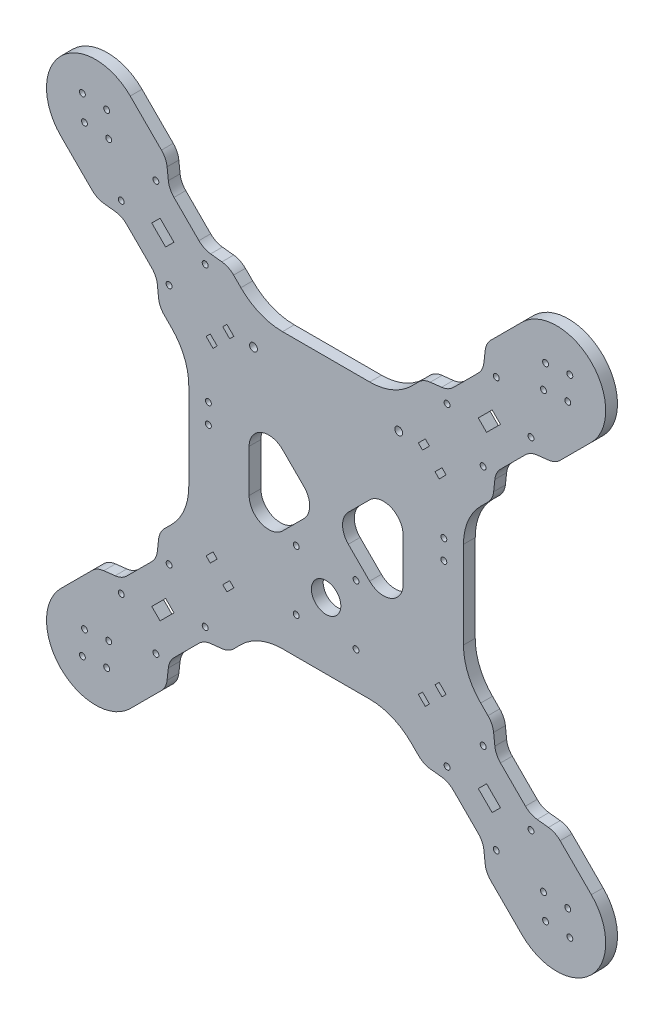
from build123d import *

# Parameters (mm, degrees)
BOSS_EXTRUDE1_DEPTH      = 6
FILLET1_R                = 30
SKETCH8_R                = 1.5
CUT_EXTRUDE1_DEPTH       = 202.614731605
SKETCH9_R                = 1.5
CUT_EXTRUDE2_DEPTH       = 202.614731605
MIRROR2_COPY_1_SKETCH_R  = 1.5
MIRROR2_COPY_1_DEPTH     = 202.614731605
MIRROR2_COPY_2_SKETCH_R  = 1.5
MIRROR2_COPY_2_DEPTH     = 202.614731605
MIRROR2_COPY_3_SKETCH_R  = 1.5
MIRROR2_COPY_3_DEPTH     = 202.614731605
MIRROR2_COPY_4_SKETCH_R  = 1.5
MIRROR2_COPY_4_DEPTH     = 202.614731605
CUT_EXTRUDE3_DEPTH       = 202.614731605
CUT_EXTRUDE3_DEPTH_BACK  = 202.614731605
SKETCH10_R               = 1.5
SKETCH10_R_2             = 1.499999999
SKETCH10_R_3             = 7.5
SKETCH10_R_4             = 2
FILLET2_R                = 10
CUT_EXTRUDE4_DEPTH       = 202.614731605
CIRPATTERN2_COUNT        = 4
CIRPATTERN2_COPY_1_DEPTH = 202.614731605
CIRPATTERN2_COPY_2_DEPTH = 202.614731605
CIRPATTERN2_COPY_3_DEPTH = 202.614731605
FILLET3_R                = 10


with BuildPart() as part:
    # Sketch4 → Boss-Extrude1 (new body)
    with BuildSketch(Plane.XY):
        with BuildLine():
            Line((-70, -34.644660941), (-70, 34.644660941))
            Line((-70, 34.644660941), (-135.17766953, 99.82233047))
            ThreePointArc((-135.17766953, 99.82233047), (-135.17766953, 135.17766953), (-99.82233047, 135.17766953))
            Line((-99.82233047, 135.17766953), (-34.644660941, 70))
            Line((-34.644660941, 70), (34.644660941, 70))
            Line((34.644660941, 70), (99.82233047, 135.17766953))
            ThreePointArc((99.82233047, 135.17766953), (135.17766953, 135.17766953), (135.17766953, 99.82233047))
            Line((135.17766953, 99.82233047), (70, 34.644660941))
            Line((70, 34.644660941), (70, -34.644660941))
            Line((70, -34.644660941), (135.17766953, -99.82233047))
            ThreePointArc((135.17766953, -99.82233047), (135.17766953, -135.17766953), (99.82233047, -135.17766953))
            Line((99.82233047, -135.17766953), (34.644660941, -70))
            Line((34.644660941, -70), (-34.644660941, -70))
            Line((-34.644660941, -70), (-99.82233047, -135.17766953))
            ThreePointArc((-99.82233047, -135.17766953), (-135.17766953, -135.17766953), (-135.17766953, -99.82233047))
            Line((-135.17766953, -99.82233047), (-70, -34.644660941))
        make_face()
    extrude(amount=BOSS_EXTRUDE1_DEPTH)

    # Fillet1
    fillet1_edges = [part.edges().sort_by_distance(p)[0] for p in [
        (34.644660941, -70, 3),
        (70, -34.644660941, 3),
        (70, 34.644660941, 3),
        (34.644660941, 70, 3),
        (-34.644660941, 70, 3),
        (-70, 34.644660941, 3),
        (-70, -34.644660941, 3),
        (-34.644660941, -70, 3),
    ]]
    fillet(fillet1_edges, radius=FILLET1_R)

    # Sketch8 → Cut-Extrude1 (cut, symmetric)
    with BuildSketch(Plane.XY.offset(6)):
        with Locations((-104.418524548, 86.740855018)):
            Circle(SKETCH8_R)
        with Locations((-80.023340597, 61.638564286)):
            Circle(SKETCH8_R)
        with Locations((-86.740855018, 104.418524548)):
            Circle(SKETCH8_R)
        with Locations((-61.638564286, 80.023340597)):
            Circle(SKETCH8_R)
        Polygon((-88.862175362, 84.619534675), (-84.619534675, 88.862175362), (-77.548466863, 81.79110755), (-81.79110755, 77.548466863), align=None)
    cut_extrude1 = extrude(amount=CUT_EXTRUDE1_DEPTH, both=True, mode=Mode.SUBTRACT)

    # Sketch9 → Cut-Extrude2 (cut, symmetric)
    with BuildSketch(Plane.XY.offset(6)):
        with Locations((-124.217514421, 124.217514421)):
            Circle(SKETCH9_R)
        with Locations((-110.782485579, 110.782485579)):
            Circle(SKETCH9_R)
        with Locations((-123.156854249, 111.843145751)):
            Circle(SKETCH9_R)
        with Locations((-111.843145751, 123.156854249)):
            Circle(SKETCH9_R)
    cut_extrude2 = extrude(amount=CUT_EXTRUDE2_DEPTH, both=True, mode=Mode.SUBTRACT)

    # Mirror1: Cut-Extrude1, Cut-Extrude2 across plane
    add(cut_extrude1.mirror(Plane(origin=(0, 0, 0), x_dir=(0, 0, 1), z_dir=(1, 0, 0))), mode=Mode.SUBTRACT)
    add(cut_extrude2.mirror(Plane(origin=(0, 0, 0), x_dir=(0, 0, 1), z_dir=(1, 0, 0))), mode=Mode.SUBTRACT)

    # Mirror2 copy 1 sketch → Mirror2 copy 1 (cut, symmetric)
    with BuildSketch(Plane(origin=(0, 0, 6), x_dir=(-1, 0, 0), z_dir=(0, 0, 1))):
        with Locations((-104.418524548, 86.740855018)):
            Circle(MIRROR2_COPY_1_SKETCH_R)
        with Locations((-80.023340597, 61.638564286)):
            Circle(MIRROR2_COPY_1_SKETCH_R)
        with Locations((-86.740855018, 104.418524548)):
            Circle(MIRROR2_COPY_1_SKETCH_R)
        with Locations((-61.638564286, 80.023340597)):
            Circle(MIRROR2_COPY_1_SKETCH_R)
        Polygon((-88.862175362, 84.619534675), (-84.619534675, 88.862175362), (-77.548466863, 81.79110755), (-81.79110755, 77.548466863), align=None)
    extrude(amount=MIRROR2_COPY_1_DEPTH, both=True, mode=Mode.SUBTRACT)

    # Mirror2 copy 2 sketch → Mirror2 copy 2 (cut, symmetric)
    with BuildSketch(Plane(origin=(0, 0, 6), x_dir=(-1, 0, 0), z_dir=(0, 0, 1))):
        with Locations((-124.217514421, 124.217514421)):
            Circle(MIRROR2_COPY_2_SKETCH_R)
        with Locations((-110.782485579, 110.782485579)):
            Circle(MIRROR2_COPY_2_SKETCH_R)
        with Locations((-123.156854249, 111.843145751)):
            Circle(MIRROR2_COPY_2_SKETCH_R)
        with Locations((-111.843145751, 123.156854249)):
            Circle(MIRROR2_COPY_2_SKETCH_R)
    extrude(amount=MIRROR2_COPY_2_DEPTH, both=True, mode=Mode.SUBTRACT)

    # Mirror2 copy 3 sketch → Mirror2 copy 3 (cut, symmetric)
    with BuildSketch(Plane.XY.offset(6)):
        with Locations((-104.418524548, -86.740855018)):
            Circle(MIRROR2_COPY_3_SKETCH_R)
        with Locations((-80.023340597, -61.638564286)):
            Circle(MIRROR2_COPY_3_SKETCH_R)
        with Locations((-86.740855018, -104.418524548)):
            Circle(MIRROR2_COPY_3_SKETCH_R)
        with Locations((-61.638564286, -80.023340597)):
            Circle(MIRROR2_COPY_3_SKETCH_R)
        Polygon((-88.862175362, -84.619534675), (-84.619534675, -88.862175362), (-77.548466863, -81.79110755), (-81.79110755, -77.548466863), align=None)
    extrude(amount=MIRROR2_COPY_3_DEPTH, both=True, mode=Mode.SUBTRACT)

    # Mirror2 copy 4 sketch → Mirror2 copy 4 (cut, symmetric)
    with BuildSketch(Plane.XY.offset(6)):
        with Locations((-124.217514421, -124.217514421)):
            Circle(MIRROR2_COPY_4_SKETCH_R)
        with Locations((-110.782485579, -110.782485579)):
            Circle(MIRROR2_COPY_4_SKETCH_R)
        with Locations((-123.156854249, -111.843145751)):
            Circle(MIRROR2_COPY_4_SKETCH_R)
        with Locations((-111.843145751, -123.156854249)):
            Circle(MIRROR2_COPY_4_SKETCH_R)
    extrude(amount=MIRROR2_COPY_4_DEPTH, both=True, mode=Mode.SUBTRACT)

    # Sketch10 → Cut-Extrude3 (cut, two sides: drawn at the far end of the back side and taken through both)
    with BuildSketch(Plane.XY.offset(6).offset(-CUT_EXTRUDE3_DEPTH_BACK)):
        with Locations((-60, 20)):
            Circle(SKETCH10_R)
        with Locations((-60, 10)):
            Circle(SKETCH10_R)
        with Locations((60, 20)):
            Circle(SKETCH10_R)
        with Locations((60, 10)):
            Circle(SKETCH10_R)
        with Locations((-15.249999999, -21)):
            Circle(SKETCH10_R_2)
        with Locations((15.249999999, -21)):
            Circle(SKETCH10_R)
        with Locations((-15.249999999, -51.5)):
            Circle(SKETCH10_R_2)
        with Locations((15.249999999, -51.5)):
            Circle(SKETCH10_R)
        with Locations((0, -36.249999999)):
            Circle(SKETCH10_R_3)
        with Locations((-37, 55.742640687)):
            Circle(SKETCH10_R_4)
        with Locations((37, 55.742640687)):
            Circle(SKETCH10_R_4)
        Polygon((-49.142135624, -53.384776311), (-47.02081528, -55.506096654), (-50.556349186, -59.04163056), (-52.67766953, -56.920310217), align=None)
        Polygon((-4.242640687, 0), (-39.242640687, 35), (-39.242640687, -35), align=None)
        Polygon((39.242640687, 35), (39.242640687, -35), (4.242640687, 0), align=None)
        Polygon((-57.627416998, -44.899494937), (-55.506096654, -47.02081528), (-59.04163056, -50.556349186), (-61.162950904, -48.435028843), align=None)
        Polygon((-61.162950904, 48.435028843), (-59.04163056, 50.556349186), (-55.506096654, 47.02081528), (-57.627416998, 44.899494937), align=None)
        Polygon((57.627416998, 44.899494937), (55.506096654, 47.02081528), (59.04163056, 50.556349186), (61.162950904, 48.435028843), align=None)
        Polygon((61.162950904, -48.435028843), (57.627416998, -44.899494937), (55.506096654, -47.02081528), (59.04163056, -50.556349186), align=None)
        Polygon((-52.67766953, 56.920310217), (-50.556349186, 59.04163056), (-47.02081528, 55.506096654), (-49.142135624, 53.384776311), align=None)
        Polygon((52.67766953, -56.920310217), (49.142135624, -53.384776311), (47.02081528, -55.506096654), (50.556349186, -59.04163056), align=None)
        Polygon((49.142135624, 53.384776311), (47.02081528, 55.506096654), (50.556349186, 59.04163056), (52.67766953, 56.920310217), align=None)
    extrude(amount=CUT_EXTRUDE3_DEPTH + CUT_EXTRUDE3_DEPTH_BACK, mode=Mode.SUBTRACT)

    # Fillet2
    fillet2_edges = [part.edges().sort_by_distance(p)[0] for p in [
        (4.242640687, 0, 3),
        (39.242640687, -35, 3),
        (39.242640687, 35, 3),
        (-39.242640687, -35, 3),
        (-39.242640687, 35, 3),
        (-4.242640687, 0, 3),
    ]]
    fillet(fillet2_edges, radius=FILLET2_R)

    # Sketch11 → Cut-Extrude4 (cut, symmetric)
    with BuildSketch(Plane.XY.offset(6)):
        Polygon((-80.023340597, 104.064971157), (-62.345671067, 86.387301628), (-49.617749006, 84.973088065), (-81.437554159, 116.792893219), align=None)
    cut_extrude4 = extrude(amount=CUT_EXTRUDE4_DEPTH, both=True, mode=Mode.SUBTRACT)

    # Mirror4: Cut-Extrude4 across plane
    add(cut_extrude4.mirror(Plane(origin=(0, 0, 0), x_dir=(0, 0, 1), z_dir=(0.7071067811865474, 0.7071067811865477, 0))), mode=Mode.SUBTRACT)

    # CirPattern2: Cut-Extrude4 ×4 about axis
    cirpattern2_axis = Axis((0, 0, 0), (0, 0, 1))
    for i in range(1, CIRPATTERN2_COUNT):
        add(cut_extrude4.rotate(cirpattern2_axis, i * 360 / CIRPATTERN2_COUNT), mode=Mode.SUBTRACT)

    # CirPattern2 copy 1 sketch → CirPattern2 copy 1 (cut, symmetric)
    with BuildSketch(Plane.XY.offset(6)):
        Polygon((-80.023340597, -104.064971157), (-62.345671067, -86.387301628), (-49.617749006, -84.973088065), (-81.437554159, -116.792893219), align=None)
    extrude(amount=CIRPATTERN2_COPY_1_DEPTH, both=True, mode=Mode.SUBTRACT)

    # CirPattern2 copy 2 sketch → CirPattern2 copy 2 (cut, symmetric)
    with BuildSketch(Plane(origin=(0, 0, 6), x_dir=(0, 1, 0), z_dir=(0, 0, 1))):
        Polygon((-80.023340597, -104.064971157), (-62.345671067, -86.387301628), (-49.617749006, -84.973088065), (-81.437554159, -116.792893219), align=None)
    extrude(amount=CIRPATTERN2_COPY_2_DEPTH, both=True, mode=Mode.SUBTRACT)

    # CirPattern2 copy 3 sketch → CirPattern2 copy 3 (cut, symmetric)
    with BuildSketch(Plane(origin=(0, 0, 6), x_dir=(-1, 0, 0), z_dir=(0, 0, 1))):
        Polygon((-80.023340597, -104.064971157), (-62.345671067, -86.387301628), (-49.617749006, -84.973088065), (-81.437554159, -116.792893219), align=None)
    extrude(amount=CIRPATTERN2_COPY_3_DEPTH, both=True, mode=Mode.SUBTRACT)

    # Fillet3
    fillet3_edges = [part.edges().sort_by_distance(p)[0] for p in [
        (-49.617749006, 84.973088065, 3),
        (-62.345671067, 86.387301628, 3),
        (-80.023340597, 104.064971157, 3),
        (-81.437554159, 116.792893219, 3),
        (116.792893219, 81.437554159, 3),
        (104.064971157, 80.023340597, 3),
        (86.387301628, 62.345671067, 3),
        (84.973088065, 49.617749006, 3),
        (80.023340597, 104.064971157, 3),
        (81.437554159, 116.792893219, 3),
        (62.345671067, 86.387301628, 3),
        (49.617749006, 84.973088065, 3),
        (116.792893219, -81.437554159, 3),
        (104.064971157, -80.023340597, 3),
        (86.387301628, -62.345671067, 3),
        (84.973088065, -49.617749006, 3),
        (81.437554159, -116.792893219, 3),
        (80.023340597, -104.064971157, 3),
        (62.345671067, -86.387301628, 3),
        (49.617749006, -84.973088065, 3),
        (-49.617749006, -84.973088065, 3),
        (-62.345671067, -86.387301628, 3),
        (-80.023340597, -104.064971157, 3),
        (-81.437554159, -116.792893219, 3),
        (-116.792893219, -81.437554159, 3),
        (-104.064971157, -80.023340597, 3),
        (-86.387301628, -62.345671067, 3),
        (-84.973088065, -49.617749006, 3),
        (-84.973088065, 49.617749006, 3),
        (-86.387301628, 62.345671067, 3),
        (-104.064971157, 80.023340597, 3),
        (-116.792893219, 81.437554159, 3),
    ]]
    fillet(fillet3_edges, radius=FILLET3_R)


solid = part.part
